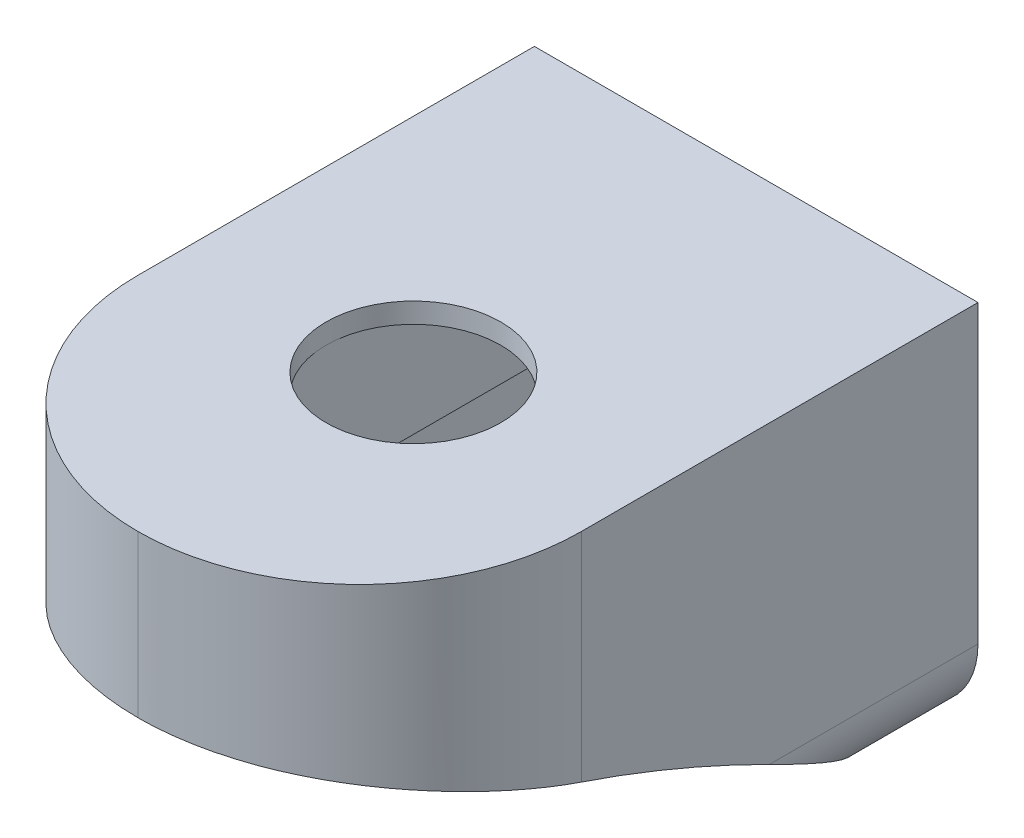
from build123d import *

# Parameters (mm, degrees)
SKETCH1_W           = 33
SKETCH1_H           = 28
BOSS_EXTRUDE1_DEPTH = 46
CUT_EXTRUDE1_DEPTH  = 59.318093247
CUT_EXTRUDE2_START  = -3
CUT_EXTRUDE2_DEPTH  = 27
FILLET1_R           = 12.5
FILLET2_R           = 16.5
FILLET3_R           = 6
SKETCH4_W           = 13
SKETCH4_H           = 23
CUT_EXTRUDE3_DEPTH  = 9
SKETCH5_R           = 6.5
CUT_EXTRUDE4_DEPTH  = 56.592265809
SKETCH6_R           = 1
CUT_EXTRUDE5_DEPTH  = 8
SKETCH7_R           = 1.3
SKETCH7_R_2         = 2.5
CUT_EXTRUDE6_DEPTH  = 2.5


with BuildPart() as part:
    # Sketch1 → Boss-Extrude1 (new body)
    with BuildSketch(Plane.XY):
        Rectangle(SKETCH1_W, SKETCH1_H)
    extrude(amount=BOSS_EXTRUDE1_DEPTH)

    # Sketch2 → Cut-Extrude1 (cut, through all)
    with BuildSketch(Plane(origin=(16.5, 0, 0), x_dir=(0, 0, -1), z_dir=(1, 0, 0))):
        with BuildLine():
            Line((-5, -14), (-46, -14))
            Line((-46, -14), (-46, 2))
            add(Edge.make_bspline(
                [(-46, 2), (-24.29854511, -1.646485385), (-5, -14)],
                knots=[0, 0, 0, 1, 1, 1], degree=2))
        make_face()
    extrude(amount=-CUT_EXTRUDE1_DEPTH, mode=Mode.SUBTRACT)

    # Sketch3 → Cut-Extrude2 (cut)
    with BuildSketch(Plane(origin=(16.5, 0, 0), x_dir=(0, 0, -1), z_dir=(1, 0, 0)).offset(CUT_EXTRUDE2_START)):
        with BuildLine():
            Line((-5, -14), (-2.5, -14))
            Line((-2.5, -14), (-2.5, 3.5))
            Line((-2.5, 3.5), (-40.5, 3.5))
            Line((-40.5, 3.5), (-40.5, 0.927448298))
            add(Edge.make_bspline(
                [(-5, -14), (-21.835639292, -3.223057237), (-40.5, 0.927448298)],
                knots=[0, 0, 0, 1, 1, 1], degree=2))
        make_face()
    extrude(amount=-CUT_EXTRUDE2_DEPTH, mode=Mode.SUBTRACT)

    # Fillet1
    fillet1_edges = [part.edges().sort_by_distance(p)[0] for p in [
        (13.5, 2.213724149, 40.5),
        (-13.5, 2.213724149, 40.5),
    ]]
    fillet(fillet1_edges, radius=FILLET1_R)

    # Fillet2
    fillet2_edges = [part.edges().sort_by_distance(p)[0] for p in [
        (16.5, 8, 46),
        (-16.5, 8, 46),
    ]]
    fillet(fillet2_edges, radius=FILLET2_R - 0.0001)  # a hair under: the kernel refuses the full size

    # Fillet3
    fillet3_edges = [part.edges().sort_by_distance(p)[0] for p in [
        (16.5, -14, 2.5),
        (-16.5, -14, 2.5),
    ]]
    fillet(fillet3_edges, radius=FILLET3_R)

    # Sketch4 → Cut-Extrude3 (cut)
    with BuildSketch(Plane.XZ.offset(-3.5)):
        with Locations((0, 20.5)):
            Rectangle(SKETCH4_W, SKETCH4_H)
    extrude(amount=-CUT_EXTRUDE3_DEPTH, mode=Mode.SUBTRACT)

    # Sketch5 → Cut-Extrude4 (cut, through all)
    with BuildSketch(Plane.XZ.offset(-12.5)):
        with Locations(Location((0, 25.5, 0), (0, 0, 270))):
            Circle(SKETCH5_R)
    extrude(amount=-CUT_EXTRUDE4_DEPTH, mode=Mode.SUBTRACT)

    # Sketch6 → Cut-Extrude5 (cut)
    with BuildSketch(Plane.XZ.offset(-3.5)):
        with Locations(Location((0, 34.034163798, 0), (0, 0, 270))):
            Circle(SKETCH6_R)
        with Locations(Location((0, 6.434163798, 0), (0, 0, 270))):
            Circle(SKETCH6_R)
    extrude(amount=-CUT_EXTRUDE5_DEPTH, mode=Mode.SUBTRACT)

    # Sketch7 → Cut-Extrude6 (cut)
    with BuildSketch(Plane(origin=(0, 0, 0), x_dir=(-1, 0, 0), z_dir=(0, 0, -1))):
        with Locations((-0.5, 0)):
            Circle(SKETCH7_R)
        with Locations((-5, 0)):
            Circle(SKETCH7_R_2)
        with Locations((-9.5, 0)):
            Circle(SKETCH7_R)
    extrude(amount=-CUT_EXTRUDE6_DEPTH, mode=Mode.SUBTRACT)


solid = part.part
